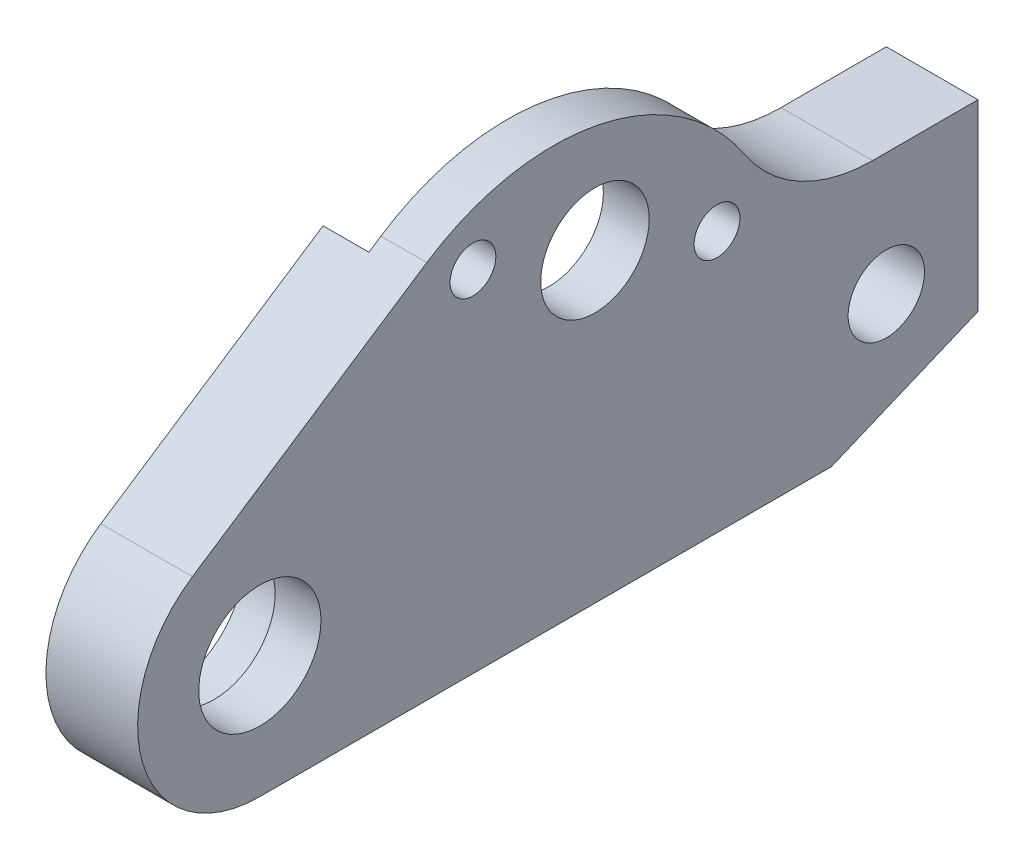
from build123d import *

# Parameters (mm, degrees)
SKETCH1_R           = 3.55
SKETCH1_R_2         = 4
SKETCH1_R_3         = 2.5
SKETCH1_R_4         = 1.5
BOSS_EXTRUDE1_DEPTH = 6
SKETCH2_R           = 4.99
CUT_EXTRUDE1_DEPTH  = 3
SKETCH3_R           = 12.55
CUT_EXTRUDE2_DEPTH  = 3


with BuildPart() as part:
    # Sketch1 → Boss-Extrude1 (new body)
    with BuildSketch(Plane(origin=(0, 0, 0), x_dir=(0, 0, -1), z_dir=(1, 0, 0))):
        with BuildLine():
            Line((-4.410283071, 6.674533934), (10.924994259, 16.807513206))
            ThreePointArc((10.924994259, 16.807513206), (22.222626062, 18.983884909), (31.738603868, 12.517104832))
            ThreePointArc((31.738603868, 12.517104832), (35.34906679, 9.201450356), (40.101489768, 8))
            Line((40.101489768, 8), (47, 8))
            Line((47, 8), (47, -4))
            Line((47, -4), (37.4, -8))
            Line((37.4, -8), (0, -8))
            ThreePointArc((0, -8), (-7.66147086, -2.302577744), (-4.410283071, 6.674533934))
        make_face()
        with Locations((21.931712199, 12)):
            Circle(SKETCH1_R, mode=Mode.SUBTRACT)
        Circle(SKETCH1_R_2, mode=Mode.SUBTRACT)
        with Locations((41, 0)):
            Circle(SKETCH1_R_3, mode=Mode.SUBTRACT)
        with Locations((29.919099476, 9.092828782)):
            Circle(SKETCH1_R_4, mode=Mode.SUBTRACT)
        with Locations((13.944324923, 14.907171218)):
            Circle(SKETCH1_R_4, mode=Mode.SUBTRACT)
    extrude(amount=BOSS_EXTRUDE1_DEPTH)

    # Sketch2 → Cut-Extrude1 (cut)
    with BuildSketch(Plane(origin=(0, 0, 0), x_dir=(0, 0, -1), z_dir=(1, 0, 0))):
        Circle(SKETCH2_R)
    extrude(amount=CUT_EXTRUDE1_DEPTH, mode=Mode.SUBTRACT)

    # Sketch3 → Cut-Extrude2 (cut)
    with BuildSketch(Plane(origin=(0, 0, 0), x_dir=(0, 0, -1), z_dir=(1, 0, 0))):
        with Locations((21.931712199, 12)):
            Circle(SKETCH3_R)
    extrude(amount=CUT_EXTRUDE2_DEPTH, mode=Mode.SUBTRACT)


solid = part.part
